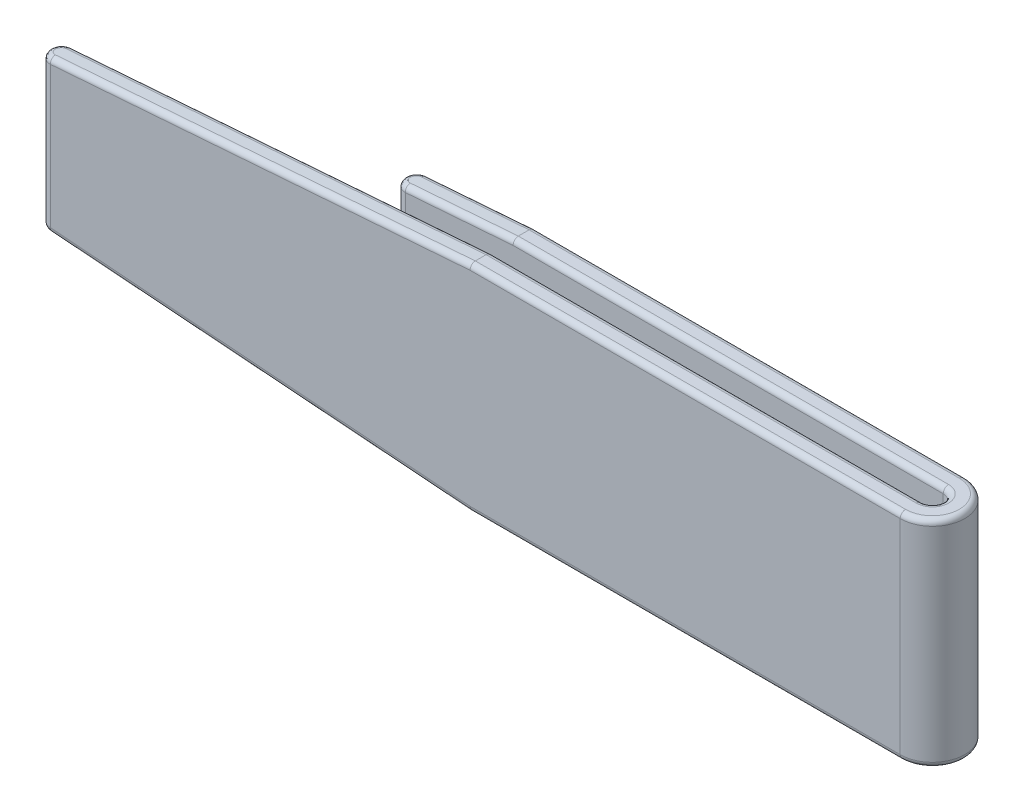
from build123d import *

# Parameters (mm, degrees)
BOSS_EXTRUDE1_DEPTH = 20
CUT_EXTRUDE4_DEPTH  = 20
FILLET1_START       = 2
FILLET1_DEPTH       = 16
FILLET3_R           = 0.5
FILLET4_R           = 0.5
SKETCH7_W           = 4.499359618
SKETCH7_H           = 13.909684308
CUT_EXTRUDE5_DEPTH  = 10
SKETCH8_W           = 1.620271182
SKETCH8_H           = 10.924255655
CUT_EXTRUDE6_DEPTH  = 10


with BuildPart() as part:
    # Sketch1 → Boss-Extrude1 (new body)
    with BuildSketch(Plane(origin=(0, 0, 0), x_dir=(1, 0, 0), z_dir=(0, 1, 0))):
        with BuildLine():
            Line((0, 0), (80, 0))
            ThreePointArc((80, 0), (83, 3), (80, 6))
            Line((80, 6), (30, 6))
            ThreePointArc((30, 6), (29, 5), (30, 4))
            Line((30, 4), (80, 4))
            ThreePointArc((80, 4), (81, 3), (80, 2))
            Line((80, 2), (0, 2))
            ThreePointArc((0, 2), (-1, 1), (0, 0))
        make_face()
    extrude(amount=BOSS_EXTRUDE1_DEPTH)

    # Sketch6 → Cut-Extrude4 (cut)
    with BuildSketch(Plane.XY):
        Polygon((40, 20), (0, 17), (0, 3), (40, 0), (-0.861925953, 0), (-0.861925953, 20), align=None)
    extrude(amount=-CUT_EXTRUDE4_DEPTH, mode=Mode.SUBTRACT)


with BuildPart() as cut_extrude4_piece_1:
    # of the separate pieces the step leaves, piece 1, a body of its own (cut_extrude4_pieces)
    add(part.part.solids().sort_by_distance((0, 3, 0))[0])

    # Fillet1: read off the stored shape, not the designer's step
    # Fillet1 outline → Fillet1 (cut)
    with BuildSketch(Plane(origin=(0, 0, 0), x_dir=(1, 0, 0), z_dir=(0, 1, 0)).offset(FILLET1_START)):
        with BuildLine():
            Line((0, 0), (1, 0))
            ThreePointArc((1, 0), (0.292893219, 0.292893219), (0, 1))
            Line((0, 1), (0, 0))
        make_face()
        with BuildLine():
            Line((0, 2), (0, 1))
            ThreePointArc((0, 1), (0.292893219, 1.707106781), (1, 2))
            Line((1, 2), (0, 2))
        make_face()
    extrude(amount=FILLET1_DEPTH, mode=Mode.SUBTRACT)

    # Fillet3
    fillet3_edges = [cut_extrude4_piece_1.edges().sort_by_distance(p)[0] for p in [
        (60, 20, -4),
        (81, 20, -3),
        (60, 20, -2),
        (60, 20, 0),
        (83, 20, -3),
        (35, 19.625, -6),
        (20.5, 18.5375, -2),
        (20.5, 18.5375, 0),
        (29, 19.175, -5),
        (0.293389183, 17.022004189, -1.707602397),
        (35, 19.625, -4),
        (60, 20, -6),
    ]]
    fillet(fillet3_edges, radius=FILLET3_R)

    # Fillet4
    fillet4_edges = [cut_extrude4_piece_1.edges().sort_by_distance(p)[0] for p in [
        (60, 0, 0),
        (83, 0, -3),
        (60, 0, -6),
        (35, 0.375, -6),
        (0.293389183, 2.977995811, -0.292397603),
        (29, 0.825, -5),
        (35, 0.375, -4),
        (60, 0, -4),
        (81, 0, -3),
        (60, 0, -2),
        (20.5, 1.4625, -2),
        (20.5, 1.4625, 0),
    ]]
    fillet(fillet4_edges, radius=FILLET4_R)


with BuildPart() as cut_extrude4_piece_2:
    # of the separate pieces the step leaves, piece 2, a body of its own (cut_extrude4_pieces)
    add(part.part.solids().sort_by_distance((-0.861925953, 0, -1.507034172))[0])

    # Sketch7 → Cut-Extrude5 (cut)
    with BuildSketch(Plane(origin=(0, 0, -2), x_dir=(-1, 0, 0), z_dir=(0, 0, -1))):
        with Locations((2.249679809, 4.537338171)):
            Rectangle(SKETCH7_W, SKETCH7_H)
    extrude(amount=-CUT_EXTRUDE5_DEPTH, mode=Mode.SUBTRACT)

    # Sketch8 → Cut-Extrude6 (cut)
    with BuildSketch(Plane.XY):
        with Locations((-1.453961148, 16.66532037)):
            Rectangle(SKETCH8_W, SKETCH8_H)
    extrude(amount=-CUT_EXTRUDE6_DEPTH, mode=Mode.SUBTRACT)


solid = cut_extrude4_piece_1.part
